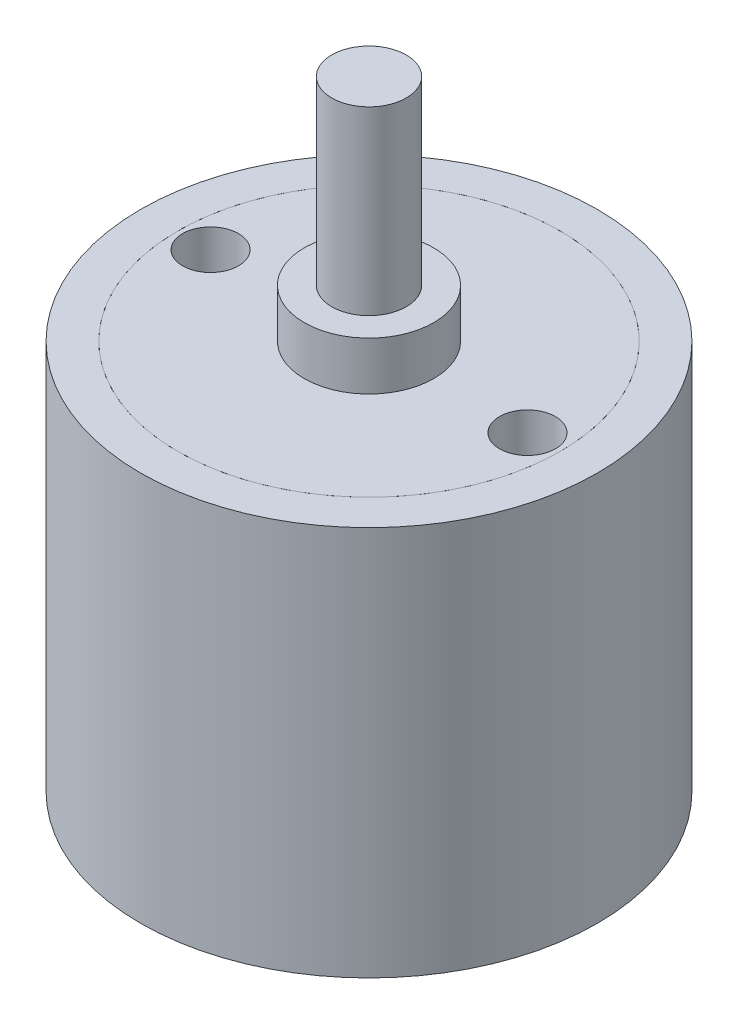
from build123d import *

# Parameters (mm, degrees)
SKETCH1_R           = 12.25
BOSS_EXTRUDE1_DEPTH = 20.92
SHELL2_START        = 3.2
SHELL2_OUTLINE_R    = 10.25
SHELL2_DEPTH        = 17.72
SKETCH2_R           = 3.175
SKETCH2_R_2         = 1.6
CUT_EXTRUDE1_DEPTH  = 8
SKETCH3_R           = 2
BOSS_EXTRUDE2_DEPTH = 12.3
SKETCH3_3_R         = 3.475
SKETCH3_3_R_2       = 2
BOSS_EXTRUDE3_DEPTH = 2.6
SKETCH4_R           = 10.25
BOSS_EXTRUDE4_DEPTH = 2.5
SKETCH5_R           = 1.5
CUT_EXTRUDE2_DEPTH  = 2.5


# Read off the part's stored shape, not the designer's step: Shell2
with BuildPart() as part:
    # Sketch1 → Boss-Extrude1 (new body)
    with BuildSketch(Plane(origin=(0, 0, 0), x_dir=(1, 0, 0), z_dir=(0, 1, 0))):
        with Locations(Location((0, 0, 0), (0, 0, 90))):
            Circle(SKETCH1_R)
    extrude(amount=BOSS_EXTRUDE1_DEPTH)

    # Shell2 outline → Shell2 (cut)
    with BuildSketch(Plane(origin=(0, 0, 0), x_dir=(1, 0, 0), z_dir=(0, 1, 0)).offset(SHELL2_START)):
        Circle(SHELL2_OUTLINE_R)
    extrude(amount=SHELL2_DEPTH, mode=Mode.SUBTRACT)

    # Sketch2 → Cut-Extrude1 (cut)
    with BuildSketch(Plane.XZ):
        with Locations(Location((0, 0, 0), (0, 0, 270))):
            Circle(SKETCH2_R)
        with Locations(Location((0, 8.5, 0), (0, 0, 270))):
            Circle(SKETCH2_R_2)
        with Locations(Location((0, -8.5, 0), (0, 0, 270))):
            Circle(SKETCH2_R_2)
    extrude(amount=-CUT_EXTRUDE1_DEPTH, mode=Mode.SUBTRACT)


with BuildPart() as body_2:
    # Sketch3 → Boss-Extrude2 (new body)
    with BuildSketch(Plane(origin=(0, 20.92, 0), x_dir=(1, 0, 0), z_dir=(0, 1, 0))):
        with Locations(Location((0, 0, 0), (0, 0, 270))):
            Circle(SKETCH3_R)
    extrude(amount=BOSS_EXTRUDE2_DEPTH)


with BuildPart() as body_3:
    # Sketch3<3> → Boss-Extrude3 (new body)
    with BuildSketch(Plane(origin=(0, 20.92, 0), x_dir=(1, 0, 0), z_dir=(0, 1, 0))):
        with Locations(Location((0, 0, 0), (0, 0, 270))):
            Circle(SKETCH3_3_R)
        with Locations(Location((0, 0, 0), (0, 0, 270))):
            Circle(SKETCH3_3_R_2, mode=Mode.SUBTRACT)
    extrude(amount=BOSS_EXTRUDE3_DEPTH)


with BuildPart() as body_4:
    # Sketch4 → Boss-Extrude4 (new body)
    with BuildSketch(Plane(origin=(0, 20.92, 0), x_dir=(1, 0, 0), z_dir=(0, 1, 0))):
        with Locations(Location((0, 0, 0), (0, 0, 270))):
            Circle(SKETCH4_R)
    extrude(amount=-BOSS_EXTRUDE4_DEPTH)

    # Sketch5 → Cut-Extrude2 (cut)
    with BuildSketch(Plane(origin=(0, 20.92, 0), x_dir=(1, 0, 0), z_dir=(0, 1, 0))):
        with Locations(Location((-8.5, 0, 0), (0, 0, 270))):
            Circle(SKETCH5_R)
        with Locations(Location((8.5, 0, 0), (0, 0, 270))):
            Circle(SKETCH5_R)
    extrude(amount=-CUT_EXTRUDE2_DEPTH, mode=Mode.SUBTRACT)


solid = Compound([part.part, body_2.part, body_3.part, body_4.part])
